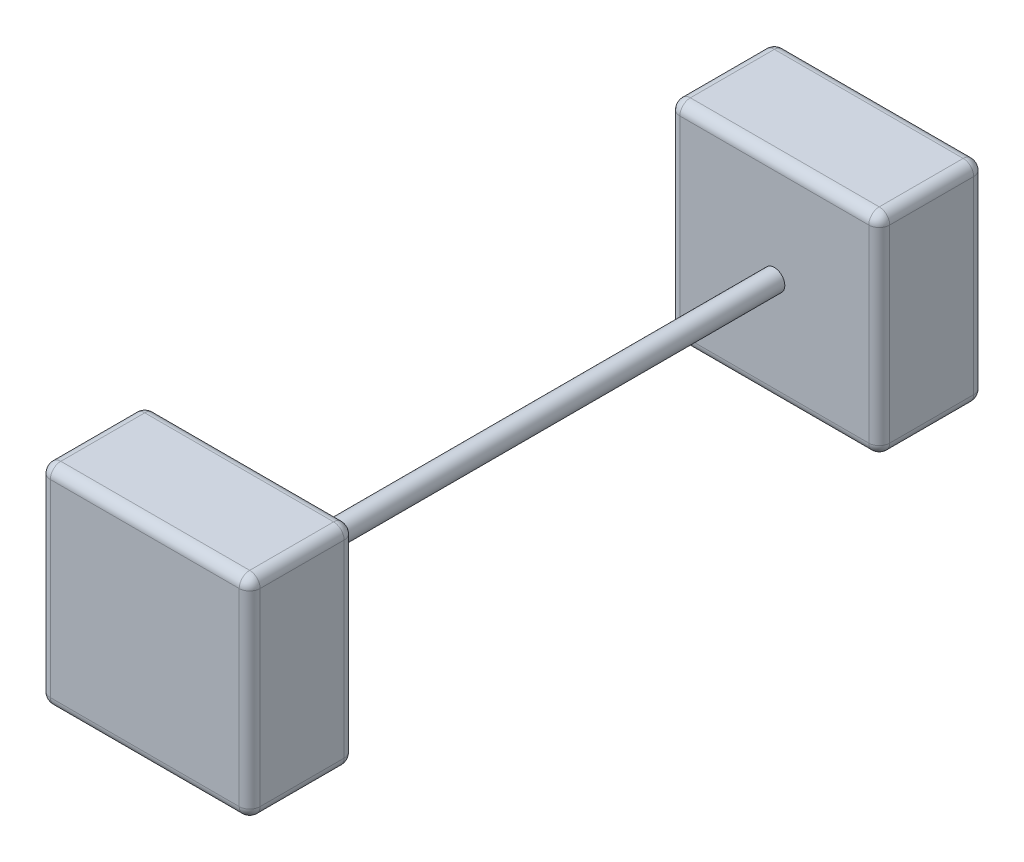
from build123d import *

# Parameters (mm, degrees)
SKETCH1_W           = 20
SKETCH1_H           = 20
BOSS_EXTRUDE1_DEPTH = 10
SKETCH4_W           = 20
SKETCH4_H           = 10
BOSS_EXTRUDE2_DEPTH = 20
FILLET6_R           = 1
FILLET7_R           = 1
BOSS_EXTRUDE3_REACH = 68.332
SKETCH6_R           = 1


with BuildPart() as part:
    # Sketch1 → Boss-Extrude1 (new body)
    with BuildSketch(Plane.XY):
        with Locations((10, 10)):
            Rectangle(SKETCH1_W, SKETCH1_H)
    extrude(amount=BOSS_EXTRUDE1_DEPTH)

    # Fillet6
    fillet6_edges = [part.edges().sort_by_distance(p)[0] for p in [
        (20, 10, 10),
        (10, 0, 10),
        (20, 0, 5),
        (20, 20, 5),
        (10, 20, 10),
        (0, 20, 5),
        (0, 10, 10),
        (0, 0, 5),
        (10, 0, 0),
        (20, 10, 0),
        (10, 20, 0),
        (0, 10, 0),
    ]]
    fillet(fillet6_edges, radius=FILLET6_R)


with BuildPart() as body_2:
    # Sketch4 → Boss-Extrude2 (new body)
    with BuildSketch(Plane(origin=(0, 0, 0), x_dir=(1, 0, 0), z_dir=(0, 1, 0))):
        with Locations((10, -65)):
            Rectangle(SKETCH4_W, SKETCH4_H)
    extrude(amount=BOSS_EXTRUDE2_DEPTH)

    # Fillet7
    fillet7_edges = [body_2.edges().sort_by_distance(p)[0] for p in [
        (0, 0, 65),
        (0, 10, 70),
        (10, 0, 70),
        (10, 20, 70),
        (0, 20, 65),
        (20, 10, 70),
        (20, 20, 65),
        (20, 0, 65),
        (20, 10, 60),
        (10, 20, 60),
        (0, 10, 60),
        (10, 0, 60),
    ]]
    fillet(fillet7_edges, radius=FILLET7_R)

    # Sketch6 → Boss-Extrude3 (add, up to next)
    with BuildSketch(Plane.XY.offset(10), mode=Mode.PRIVATE) as boss_extrude3_sk1:
        with Locations((10, 10)):
            Circle(SKETCH6_R)
    boss_extrude3_tool1 = extrude(boss_extrude3_sk1.sketch, amount=BOSS_EXTRUDE3_REACH, mode=Mode.PRIVATE) - body_2.part

    add(part.part)  # Boss-Extrude3 merges part
    add(boss_extrude3_tool1.solids().sort_by_distance((10, 10, 10))[0])


solid = body_2.part
